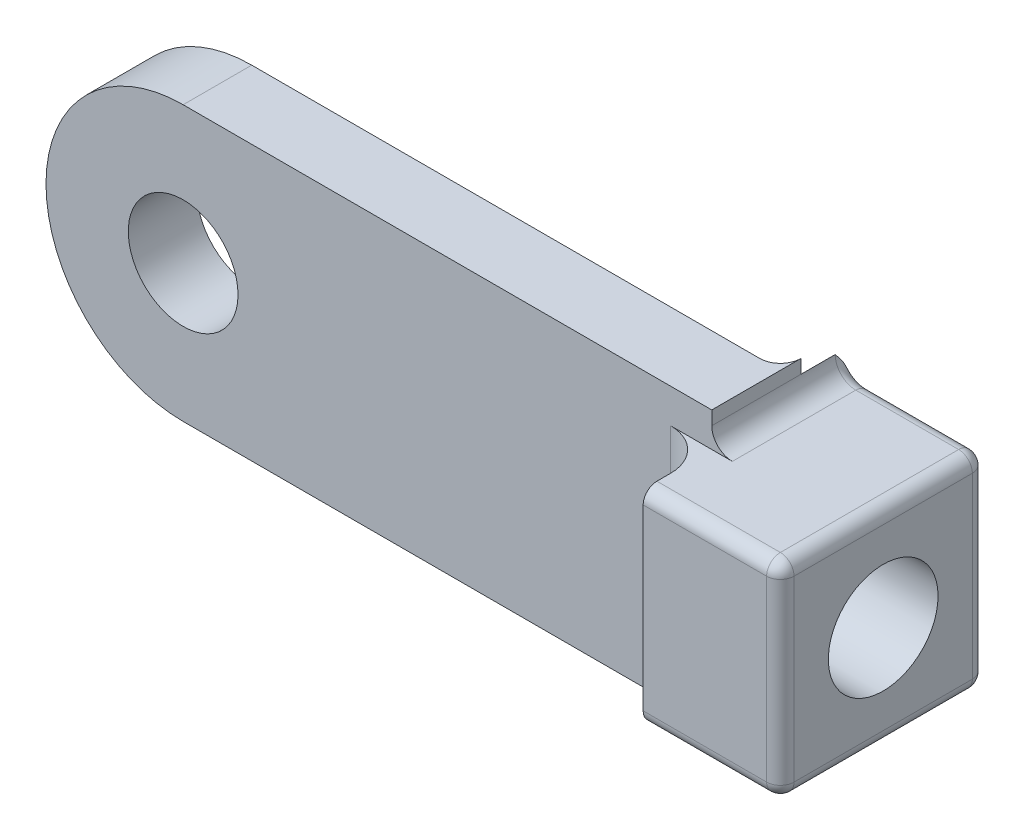
from build123d import *

# Parameters (mm, degrees)
SKETCH1_R           = 4
BOSS_EXTRUDE1_DEPTH = 5
SKETCH2_W           = 25.16319253
SKETCH2_H           = 20
CUT_EXTRUDE1_DEPTH  = 35.369317712
SKETCH3_W           = 15
SKETCH3_H           = 15
BOSS_EXTRUDE2_DEPTH = 10
FILLET1_R           = 1.5
FILLET2_R           = 3
SKETCH4_R           = 4
CUT_EXTRUDE2_DEPTH  = 8
FILLET3_R           = 1
FILLET4_R           = 1


with BuildPart() as part:
    # Sketch1 → Boss-Extrude1 (new body)
    with BuildSketch(Plane.XY):
        with BuildLine():
            Line((-22.5, 10), (22.5, 10))
            ThreePointArc((22.5, 10), (32.5, 0), (22.5, -10))
            Line((22.5, -10), (-22.5, -10))
            ThreePointArc((-22.5, -10), (-32.5, 0), (-22.5, 10))
        make_face()
        with Locations((-22.5, 0)):
            Circle(SKETCH1_R, mode=Mode.SUBTRACT)
        with Locations((22.5, 0)):
            Circle(SKETCH1_R, mode=Mode.SUBTRACT)
    extrude(amount=BOSS_EXTRUDE1_DEPTH)

    # Sketch2 → Cut-Extrude1 (cut, through all)
    with BuildSketch(Plane.XY.offset(5)):
        with Locations((28.623168012, 0)):
            Rectangle(SKETCH2_W, SKETCH2_H)
    extrude(amount=-CUT_EXTRUDE1_DEPTH, mode=Mode.SUBTRACT)

    # Sketch3 → Boss-Extrude2 (add)
    with BuildSketch(Plane(origin=(16.041571747, 0, 0), x_dir=(0, 0, -1), z_dir=(1, 0, 0))):
        with Locations((-2.5, 0)):
            Rectangle(SKETCH3_W, SKETCH3_H)
    extrude(amount=BOSS_EXTRUDE2_DEPTH)

    # Fillet1
    # the kernel refuses this fillet: 1.5 mm, written as the material it adds along each edge
    with BuildSketch(Plane(origin=(16.041571747, 11.25, 0), x_dir=(-1, 0, 0), z_dir=(0, -1, 0))) as fillet1_piece_1_section:
        with BuildLine():
            CenterArc((FILLET1_R, FILLET1_R), FILLET1_R, 180, 90)
            Line((0, FILLET1_R), (0, 0))
            Line((0, 0), (FILLET1_R, 0))
        make_face()
    fillet1_piece_1 = extrude(amount=22.5, mode=Mode.PRIVATE)
    fillet1_piece_1 = split(fillet1_piece_1, bisect_by=Plane(origin=(16.041571747, 10, 0), z_dir=(0, -1, 0)), keep=Keep.TOP, mode=Mode.PRIVATE)
    fillet1_piece_1 = split(fillet1_piece_1, bisect_by=Plane(origin=(16.041571747, -10, 0), z_dir=(0, 1, 0)), keep=Keep.TOP, mode=Mode.PRIVATE)
    add(fillet1_piece_1)
    # the kernel refuses this fillet: 1.5 mm, written as the material it adds along each edge
    with BuildSketch(Plane(origin=(16.041571747, 7.5, 5), x_dir=(1, 0, 0), z_dir=(0, 0, -1))) as fillet1_2_piece_1_section:
        with BuildLine():
            CenterArc((FILLET1_R, -FILLET1_R), FILLET1_R, 90, 90)
            Line((0, -FILLET1_R), (0, 0))
            Line((0, 0), (FILLET1_R, 0))
        make_face()
    fillet1_2_piece_1 = extrude(amount=10.25, mode=Mode.PRIVATE)
    fillet1_2_piece_1 = split(fillet1_2_piece_1, bisect_by=Plane(origin=(16.041571747, 7.5, -5), z_dir=(0, 0, 1)), keep=Keep.TOP, mode=Mode.PRIVATE)
    add(fillet1_2_piece_1)
    # the kernel refuses this fillet: 1.5 mm, written as the material it adds along each edge
    with BuildSketch(Plane(origin=(16.041571747, -7.5, -5.25), x_dir=(1, 0, 0), z_dir=(0, 0, 1))) as fillet1_3_piece_1_section:
        with BuildLine():
            CenterArc((FILLET1_R, -FILLET1_R), FILLET1_R, 90, 90)
            Line((0, -FILLET1_R), (0, 0))
            Line((0, 0), (FILLET1_R, 0))
        make_face()
    fillet1_3_piece_1 = extrude(amount=10.25, mode=Mode.PRIVATE)
    fillet1_3_piece_1 = split(fillet1_3_piece_1, bisect_by=Plane(origin=(16.041571747, -7.5, -5), z_dir=(0, 0, 1)), keep=Keep.TOP, mode=Mode.PRIVATE)
    add(fillet1_3_piece_1)

    # Fillet2
    fillet2_edges = [part.edges().sort_by_distance(p)[0] for p in [
        (16.041571747, 0, 5),
    ]]
    fillet(fillet2_edges, radius=FILLET2_R)

    # Sketch4 → Cut-Extrude2 (cut)
    with BuildSketch(Plane(origin=(26.041571747, 0, 0), x_dir=(0, 0, -1), z_dir=(1, 0, 0))):
        with Locations((-2.5, 0)):
            Circle(SKETCH4_R)
    extrude(amount=-CUT_EXTRUDE2_DEPTH, mode=Mode.SUBTRACT)

    # Fillet3
    fillet3_edges = [part.edges().sort_by_distance(p)[0] for p in [
        (21.791571747, -7.5, -5),
        (21.791571747, 7.5, -5),
        (21.041571747, 7.5, 10),
        (21.041571747, -7.5, 10),
        (16.480911575, 7.939339828, -5),
        (16.480911575, -7.939339828, -5),
    ]]
    fillet(fillet3_edges, radius=FILLET3_R)

    # Fillet4
    fillet4_edges = [part.edges().sort_by_distance(p)[0] for p in [
        (26.041571747, 0, -5),
        (26.041571747, -7.5, 2.5),
        (26.041571747, 7.5, 2.5),
        (26.041571747, 0, 10),
        (26.041571747, 7.207106781, -4.707106781),
        (26.041571747, 7.207106781, 9.707106781),
        (26.041571747, -7.207106781, 9.707106781),
        (26.041571747, -7.207106781, -4.707106781),
    ]]
    fillet(fillet4_edges, radius=FILLET4_R)


solid = part.part
